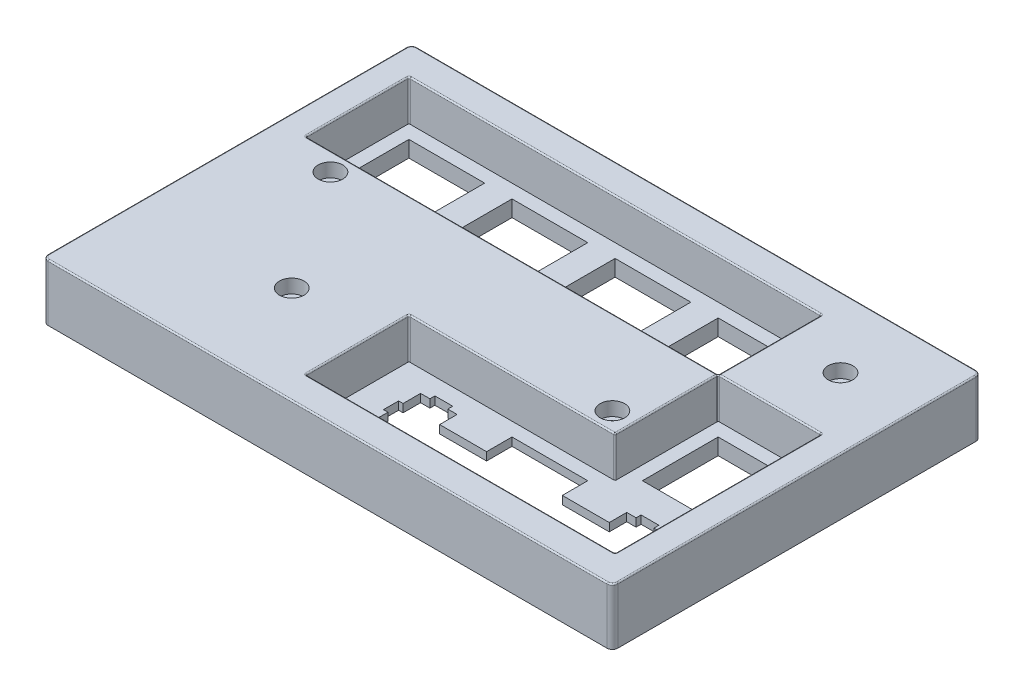
from build123d import *

# Parameters (mm, degrees)
SKETCH5_W           = 105.25
SKETCH5_H           = 68.15
SKETCH5_W_2         = 13.9993
SKETCH5_H_2         = 13.9994
SKETCH5_H_3         = 13.9993
SKETCH5_W_3         = 13.99955
BOSS_EXTRUDE1_DEPTH = 3
SKETCH6_W           = 52.0993
SKETCH6_H           = 19.04996
CUT_EXTRUDE1_DEPTH  = 1.5
SKETCH7_W           = 105.25
SKETCH7_H           = 68.15
SKETCH7_W_2         = 95.2498
SKETCH7_H_2         = 57.150035
BOSS_EXTRUDE2_DEPTH = 7.5
SKETCH9_R           = 1.35
CUT_EXTRUDE3_DEPTH  = 119.670818994
BOSS_EXTRUDE4_START = 7.5
SKETCH10_R          = 1.35
BOSS_EXTRUDE4_DEPTH = 7.5
SKETCH13_R          = 2.275
CUT_EXTRUDE5_DEPTH  = 2.55
FILLET1_R           = 0.25
FILLET2_R           = 1
FILLET3_R           = 0.25


with BuildPart() as part:
    # Sketch5 → Boss-Extrude1 (new body)
    with BuildSketch(Plane(origin=(0, 0, 0), x_dir=(1, 0, 0), z_dir=(0, 1, 0))):
        with Locations((47.7201423, 28.8325965)):
            Rectangle(SKETCH5_W, SKETCH5_H)
        Polygon((82.4438, 7.48273), (82.4438, 3.01377), (84.1692, 3.01377), (84.1692, 2.03261), (87.4695, 2.03261), (87.4695, 3.01377), (89.1949, 3.01377), (89.1949, 9.28384), (90.019, 9.28384), (90.019, 12.0826), (89.1949, 12.0826), (89.1949, 15.3128), (87.4695, 15.3128), (87.4695, 16.2333), (84.1692, 16.2333), (84.1692, 15.3128), (82.4438, 15.3128), (82.4438, 12.0826), (73.769, 12.0826), (73.769, 16.7831), (59.7697, 16.7831), (59.7697, 12.0826), (51.0949, 12.0826), (51.0949, 15.3128), (49.3695, 15.3128), (49.3695, 16.2333), (46.0692, 16.2333), (46.0692, 15.3128), (44.3438, 15.3128), (44.3438, 12.0826), (43.5197, 12.0826), (43.5197, 9.28384), (44.3438, 9.28384), (44.3438, 3.01377), (46.0692, 3.01377), (46.0692, 2.03261), (49.3695, 2.03261), (49.3695, 3.01377), (51.0949, 3.01377), (51.0949, 7.48273), (59.7697, 7.48273), (59.7697, 2.78364), (73.769, 2.78364), (73.769, 7.48273), align=None, mode=Mode.SUBTRACT)
        with Locations((85.81935, 28.8333)):
            Rectangle(SKETCH5_W_2, SKETCH5_H_2, mode=Mode.SUBTRACT)
        with Locations((66.76935, 47.88345)):
            Rectangle(SKETCH5_W_2, SKETCH5_H_3, mode=Mode.SUBTRACT)
        with Locations((47.71935, 47.88345)):
            Rectangle(SKETCH5_W_2, SKETCH5_H_3, mode=Mode.SUBTRACT)
        with Locations((28.66935, 47.88345)):
            Rectangle(SKETCH5_W_2, SKETCH5_H_3, mode=Mode.SUBTRACT)
        with Locations((9.619425, 47.88345)):
            Rectangle(SKETCH5_W_3, SKETCH5_H_3, mode=Mode.SUBTRACT)
    extrude(amount=BOSS_EXTRUDE1_DEPTH)

    # Sketch6 → Cut-Extrude1 (cut)
    with BuildSketch(Plane.XZ):
        with Locations((66.76935, -9.78337)):
            Rectangle(SKETCH6_W, SKETCH6_H)
    extrude(amount=-CUT_EXTRUDE1_DEPTH, mode=Mode.SUBTRACT)

    # Sketch7 → Boss-Extrude2 (add)
    with BuildSketch(Plane(origin=(0, 3, 0), x_dir=(1, 0, 0), z_dir=(0, 1, 0))):
        with Locations((47.7201423, 28.8325965)):
            Rectangle(SKETCH7_W, SKETCH7_H)
        with Locations((47.719325, 28.8334325)):
            Rectangle(SKETCH7_W_2, SKETCH7_H_2, mode=Mode.SUBTRACT)
    extrude(amount=BOSS_EXTRUDE2_DEPTH)

    # Sketch9 → Cut-Extrude3 (cut, through all)
    with BuildSketch(Plane(origin=(0, 3, 0), x_dir=(1, 0, 0), z_dir=(0, 1, 0))):
        with Locations(Location((8.094325, 34.9084325, 0), (0, 0, 270))):
            Circle(SKETCH9_R)
        with Locations(Location((23.094325, 12.7584325, 0), (0, 0, 270))):
            Circle(SKETCH9_R)
        with Locations(Location((87.344325, 49.9084325, 0), (0, 0, 270))):
            Circle(SKETCH9_R)
        with Locations(Location((72.344325, 22.7584325, 0), (0, 0, 270))):
            Circle(SKETCH9_R)
    extrude(amount=-CUT_EXTRUDE3_DEPTH, mode=Mode.SUBTRACT)

    # Sketch10 → Boss-Extrude4 (add)
    with BuildSketch(Plane(origin=(0, 3, 0), x_dir=(1, 0, 0), z_dir=(0, 1, 0)).offset(BOSS_EXTRUDE4_START)):
        with BuildLine():
            Line((76.29435, 57.40845), (76.29435, 38.60845))
            ThreePointArc((76.29435, 38.60845), (76.221126695, 38.431673305), (76.04435, 38.35845))
            Line((76.04435, 38.35845), (0.094425, 38.35845))
            Line((0.094425, 38.35845), (0, 0))
            Line((0, 0), (38.194225, 0.258415))
            Line((38.194225, 0.258415), (38.194225, 19.30845))
            Line((38.194225, 19.30845), (76.29435, 19.30845))
            Line((76.29435, 19.30845), (76.29435, 38.10845))
            ThreePointArc((76.29435, 38.10845), (76.367573305, 38.285226695), (76.54435, 38.35845))
            Line((76.54435, 38.35845), (95.344225, 38.35845))
            Line((95.344225, 38.35845), (95.344225, 57.40845))
            Line((95.344225, 57.40845), (76.29435, 57.40845))
        make_face()
        with Locations(Location((72.344325, 22.7584325, 0), (0, 0, 270))):
            Circle(SKETCH10_R, mode=Mode.SUBTRACT)
        with Locations(Location((23.094325, 12.7584325, 0), (0, 0, 270))):
            Circle(SKETCH10_R, mode=Mode.SUBTRACT)
        with Locations(Location((8.094325, 34.9084325, 0), (0, 0, 270))):
            Circle(SKETCH10_R, mode=Mode.SUBTRACT)
        with Locations(Location((87.344325, 49.9084325, 0), (0, 0, 270))):
            Circle(SKETCH10_R, mode=Mode.SUBTRACT)
    extrude(amount=-BOSS_EXTRUDE4_DEPTH)

    # Sketch13 → Cut-Extrude5 (cut)
    with BuildSketch(Plane(origin=(0, 10.5, 0), x_dir=(1, 0, 0), z_dir=(0, 1, 0))):
        with Locations(Location((8.094325, 34.9084325, 0), (0, 0, 270))):
            Circle(SKETCH13_R)
        with Locations(Location((23.094325, 12.7584325, 0), (0, 0, 270))):
            Circle(SKETCH13_R)
        with Locations(Location((87.344325, 49.9084325, 0), (0, 0, 270))):
            Circle(SKETCH13_R)
        with Locations(Location((72.344325, 22.7584325, 0), (0, 0, 270))):
            Circle(SKETCH13_R)
    extrude(amount=-CUT_EXTRUDE5_DEPTH, mode=Mode.SUBTRACT)

    # Fillet1
    fillet1_edges = [part.edges().sort_by_distance(p)[0] for p in [
        (95.344225, 6.75, -0.258415),
        (0.094425, 6.75, -57.40845),
        (76.29435, 6.75, -57.40845),
        (95.344225, 6.75, -38.35845),
        (76.29435, 6.75, -19.30845),
        (38.194225, 6.75, -19.30845),
        (38.194225, 6.75, -0.258415),
        (0.094425, 6.75, -38.35845),
    ]]
    fillet(fillet1_edges, radius=FILLET1_R)

    # Fillet2
    fillet2_edges = [part.edges().sort_by_distance(p)[0] for p in [
        (-4.9048577, 5.25, -62.9075965),
        (100.3451423, 5.25, -62.9075965),
        (100.3451423, 5.25, 5.2424035),
        (-4.9048577, 5.25, 5.2424035),
    ]]
    fillet(fillet2_edges, radius=FILLET2_R)

    # Fillet3
    # the kernel refuses this fillet: 0.25 mm, written as the material it takes off along each edge
    with BuildSketch(Plane(origin=(76.04435, 10.5, -38.35845), x_dir=(0, 0, 1), z_dir=(-1, 0, 0)), Plane(origin=(0.344425, 10.5, -57.40845), x_dir=(0, 0, -1), z_dir=(1, 0, 0))) as fillet3_piece_1:
        with BuildLine():
            CenterArc((FILLET3_R, -FILLET3_R), FILLET3_R, 90, 90)
            Line((0, -FILLET3_R), (0, 0))
            Line((0, 0), (FILLET3_R, 0))
        make_face()
    extrude(amount=75.699925, mode=Mode.SUBTRACT)
    with BuildSketch(Plane(origin=(76.54435, 10.5, -38.10845), x_dir=(-1, 0, 0), z_dir=(0, 0, 1))) as fillet3_piece_2:
        with BuildLine():
            CenterArc((0.25 + FILLET3_R, FILLET3_R), FILLET3_R, 180, 90)
            Line((0.25, FILLET3_R), (0.25, 0))
            Line((0.25, 0), (0.25 + FILLET3_R, 0))
        make_face()
    revolve(axis=Axis((76.54435, 10.5, -38.10845), (0, -1, 0)), revolution_arc=90, mode=Mode.SUBTRACT)
    with BuildSketch(Plane(origin=(76.54435, 10.5, -38.35845), x_dir=(0, 0, -1), z_dir=(1, 0, 0))) as fillet3_piece_3:
        with BuildLine():
            CenterArc((FILLET3_R, -FILLET3_R), FILLET3_R, 90, 90)
            Line((0, -FILLET3_R), (0, 0))
            Line((0, 0), (FILLET3_R, 0))
        make_face()
    extrude(amount=18.549875, mode=Mode.SUBTRACT)
    with BuildSketch(Plane(origin=(76.04435, 10.5, -38.60845), x_dir=(1, 0, 0), z_dir=(0, 0, -1))) as fillet3_piece_4:
        with BuildLine():
            CenterArc((0.25 + FILLET3_R, FILLET3_R), FILLET3_R, 180, 90)
            Line((0.25, FILLET3_R), (0.25, 0))
            Line((0.25, 0), (0.25 + FILLET3_R, 0))
        make_face()
    revolve(axis=Axis((76.04435, 10.5, -38.60845), (0, -1, 0)), revolution_arc=90, mode=Mode.SUBTRACT)
    with BuildSketch(Plane(origin=(0.094425, 10.5, -38.60845), x_dir=(-1, 0, 0), z_dir=(0, 0, -1)), Plane(origin=(76.29435, 10.5, -57.15845), x_dir=(1, 0, 0), z_dir=(0, 0, 1)), Plane(origin=(76.29435, 10.5, -19.55845), x_dir=(-1, 0, 0), z_dir=(0, 0, -1))) as fillet3_piece_5:
        with BuildLine():
            CenterArc((FILLET3_R, -FILLET3_R), FILLET3_R, 90, 90)
            Line((0, -FILLET3_R), (0, 0))
            Line((0, 0), (FILLET3_R, 0))
        make_face()
    extrude(amount=18.55, mode=Mode.SUBTRACT)
    with BuildSketch(Plane(origin=(38.444225, 10.5, -19.30845), x_dir=(0, 0, -1), z_dir=(1, 0, 0))) as fillet3_piece_6:
        with BuildLine():
            CenterArc((FILLET3_R, -FILLET3_R), FILLET3_R, 90, 90)
            Line((0, -FILLET3_R), (0, 0))
            Line((0, 0), (FILLET3_R, 0))
        make_face()
    extrude(amount=37.600125, mode=Mode.SUBTRACT)
    with BuildSketch(Plane(origin=(38.194225, 10.5, -0.508415), x_dir=(-1, 0, 0), z_dir=(0, 0, -1))) as fillet3_piece_7:
        with BuildLine():
            CenterArc((FILLET3_R, -FILLET3_R), FILLET3_R, 90, 90)
            Line((0, -FILLET3_R), (0, 0))
            Line((0, 0), (FILLET3_R, 0))
        make_face()
    extrude(amount=18.550035, mode=Mode.SUBTRACT)
    with BuildSketch(Plane(origin=(95.094225, 10.5, -0.258415), x_dir=(0, 0, 1), z_dir=(-1, 0, 0))) as fillet3_piece_8:
        with BuildLine():
            CenterArc((FILLET3_R, -FILLET3_R), FILLET3_R, 90, 90)
            Line((0, -FILLET3_R), (0, 0))
            Line((0, 0), (FILLET3_R, 0))
        make_face()
    extrude(amount=56.65, mode=Mode.SUBTRACT)
    with BuildSketch(Plane(origin=(95.344225, 10.5, -38.10845), x_dir=(1, 0, 0), z_dir=(0, 0, 1))) as fillet3_piece_9:
        with BuildLine():
            CenterArc((FILLET3_R, -FILLET3_R), FILLET3_R, 90, 90)
            Line((0, -FILLET3_R), (0, 0))
            Line((0, 0), (FILLET3_R, 0))
        make_face()
    extrude(amount=37.600035, mode=Mode.SUBTRACT)
    with BuildSketch(Plane(origin=(76.04435, 10.5, -19.55845), x_dir=(0, 0, 1), z_dir=(-1, 0, 0))) as fillet3_piece_10:
        with BuildLine():
            CenterArc((0.25 - FILLET3_R, -FILLET3_R), FILLET3_R, 0, 90)
            Line((0.25, -FILLET3_R), (0.25, 0))
            Line((0.25, 0), (0.25 - FILLET3_R, 0))
        make_face()
    revolve(axis=Axis((76.04435, 10.5, -19.55845), (0, 1, 0)), revolution_arc=90, mode=Mode.SUBTRACT)
    with BuildSketch(Plane(origin=(0.344425, 10.5, -38.60845), x_dir=(-1, 0, 0), z_dir=(0, 0, -1))) as fillet3_piece_11:
        with BuildLine():
            CenterArc((0.25 + FILLET3_R, -FILLET3_R), FILLET3_R, 90, 90)
            Line((0.25, -FILLET3_R), (0.25, 0))
            Line((0.25, 0), (0.25 + FILLET3_R, 0))
        make_face()
    revolve(axis=Axis((0.344425, 10.5, -38.60845), (0, 1, 0)), revolution_arc=90, mode=Mode.SUBTRACT)
    with BuildSketch(Plane(origin=(76.04435, 10.5, -57.15845), x_dir=(0, 0, -1), z_dir=(-1, 0, 0))) as fillet3_piece_12:
        with BuildLine():
            CenterArc((0.25 + FILLET3_R, FILLET3_R), FILLET3_R, 180, 90)
            Line((0.25, FILLET3_R), (0.25, 0))
            Line((0.25, 0), (0.25 + FILLET3_R, 0))
        make_face()
    revolve(axis=Axis((76.04435, 10.5, -57.15845), (0, -1, 0)), revolution_arc=90, mode=Mode.SUBTRACT)
    with BuildSketch(Plane(origin=(0.344425, 10.5, -57.15845), x_dir=(-1, 0, 0), z_dir=(0, 0, 1))) as fillet3_piece_13:
        with BuildLine():
            CenterArc((0.25 + FILLET3_R, FILLET3_R), FILLET3_R, 180, 90)
            Line((0.25, FILLET3_R), (0.25, 0))
            Line((0.25, 0), (0.25 + FILLET3_R, 0))
        make_face()
    revolve(axis=Axis((0.344425, 10.5, -57.15845), (0, -1, 0)), revolution_arc=90, mode=Mode.SUBTRACT)
    with BuildSketch(Plane(origin=(38.444225, 10.5, -19.05845), x_dir=(-1, 0, 0), z_dir=(0, 0, 1))) as fillet3_piece_14:
        with BuildLine():
            CenterArc((0.25 + FILLET3_R, FILLET3_R), FILLET3_R, 180, 90)
            Line((0.25, FILLET3_R), (0.25, 0))
            Line((0.25, 0), (0.25 + FILLET3_R, 0))
        make_face()
    revolve(axis=Axis((38.444225, 10.5, -19.05845), (0, -1, 0)), revolution_arc=90, mode=Mode.SUBTRACT)
    with BuildSketch(Plane(origin=(38.444225, 10.5, -0.508415), x_dir=(0, 0, 1), z_dir=(1, 0, 0))) as fillet3_piece_15:
        with BuildLine():
            CenterArc((0.25 + FILLET3_R, FILLET3_R), FILLET3_R, 180, 90)
            Line((0.25, FILLET3_R), (0.25, 0))
            Line((0.25, 0), (0.25 + FILLET3_R, 0))
        make_face()
    revolve(axis=Axis((38.444225, 10.5, -0.508415), (0, -1, 0)), revolution_arc=90, mode=Mode.SUBTRACT)
    with BuildSketch(Plane(origin=(95.094225, 10.5, -0.508415), x_dir=(0, 0, 1), z_dir=(-1, 0, 0))) as fillet3_piece_16:
        with BuildLine():
            CenterArc((0.25 + FILLET3_R, -FILLET3_R), FILLET3_R, 90, 90)
            Line((0.25, -FILLET3_R), (0.25, 0))
            Line((0.25, 0), (0.25 + FILLET3_R, 0))
        make_face()
    revolve(axis=Axis((95.094225, 10.5, -0.508415), (0, 1, 0)), revolution_arc=90, mode=Mode.SUBTRACT)
    with BuildSketch(Plane(origin=(95.094225, 10.5, -38.10845), x_dir=(1, 0, 0), z_dir=(0, 0, 1))) as fillet3_piece_17:
        with BuildLine():
            CenterArc((0.25 + FILLET3_R, -FILLET3_R), FILLET3_R, 90, 90)
            Line((0.25, -FILLET3_R), (0.25, 0))
            Line((0.25, 0), (0.25 + FILLET3_R, 0))
        make_face()
    revolve(axis=Axis((95.094225, 10.5, -38.10845), (0, 1, 0)), revolution_arc=90, mode=Mode.SUBTRACT)
    with BuildSketch(Plane(origin=(99.3451423, 10.5, -62.9075965), x_dir=(0, 0, 1), z_dir=(-1, 0, 0)), Plane(origin=(-3.9048577, 10.5, 5.2424035), x_dir=(0, 0, -1), z_dir=(1, 0, 0))) as fillet3_piece_18:
        with BuildLine():
            CenterArc((FILLET3_R, -FILLET3_R), FILLET3_R, 90, 90)
            Line((0, -FILLET3_R), (0, 0))
            Line((0, 0), (FILLET3_R, 0))
        make_face()
    extrude(amount=103.25, mode=Mode.SUBTRACT)
    with BuildSketch(Plane(origin=(100.3451423, 10.5, 4.2424035), x_dir=(-1, 0, 0), z_dir=(0, 0, -1)), Plane(origin=(-4.9048577, 10.5, -61.9075965), x_dir=(1, 0, 0), z_dir=(0, 0, 1))) as fillet3_piece_19:
        with BuildLine():
            CenterArc((FILLET3_R, -FILLET3_R), FILLET3_R, 90, 90)
            Line((0, -FILLET3_R), (0, 0))
            Line((0, 0), (FILLET3_R, 0))
        make_face()
    extrude(amount=66.15, mode=Mode.SUBTRACT)
    with BuildSketch(Plane(origin=(-3.9048577, 10.5, -61.9075965), x_dir=(0, 0, -1), z_dir=(1, 0, 0))) as fillet3_piece_20:
        with BuildLine():
            CenterArc((1 - FILLET3_R, -FILLET3_R), FILLET3_R, 0, 90)
            Line((1, -FILLET3_R), (1, 0))
            Line((1, 0), (1 - FILLET3_R, 0))
        make_face()
    revolve(axis=Axis((-3.9048577, 10.5, -61.9075965), (0, 1, 0)), revolution_arc=90, mode=Mode.SUBTRACT)
    with BuildSketch(Plane(origin=(-3.9048577, 10.5, 4.2424035), x_dir=(0, 0, 1), z_dir=(1, 0, 0))) as fillet3_piece_21:
        with BuildLine():
            CenterArc((1 - FILLET3_R, FILLET3_R), FILLET3_R, 270, 90)
            Line((1, FILLET3_R), (1, 0))
            Line((1, 0), (1 - FILLET3_R, 0))
        make_face()
    revolve(axis=Axis((-3.9048577, 10.5, 4.2424035), (0, -1, 0)), revolution_arc=90, mode=Mode.SUBTRACT)
    with BuildSketch(Plane(origin=(99.3451423, 10.5, 4.2424035), x_dir=(1, 0, 0), z_dir=(0, 0, -1))) as fillet3_piece_22:
        with BuildLine():
            CenterArc((1 - FILLET3_R, FILLET3_R), FILLET3_R, 270, 90)
            Line((1, FILLET3_R), (1, 0))
            Line((1, 0), (1 - FILLET3_R, 0))
        make_face()
    revolve(axis=Axis((99.3451423, 10.5, 4.2424035), (0, -1, 0)), revolution_arc=90, mode=Mode.SUBTRACT)
    with BuildSketch(Plane(origin=(99.3451423, 10.5, -61.9075965), x_dir=(1, 0, 0), z_dir=(0, 0, 1))) as fillet3_piece_23:
        with BuildLine():
            CenterArc((1 - FILLET3_R, -FILLET3_R), FILLET3_R, 0, 90)
            Line((1, -FILLET3_R), (1, 0))
            Line((1, 0), (1 - FILLET3_R, 0))
        make_face()
    revolve(axis=Axis((99.3451423, 10.5, -61.9075965), (0, 1, 0)), revolution_arc=90, mode=Mode.SUBTRACT)


solid = part.part
